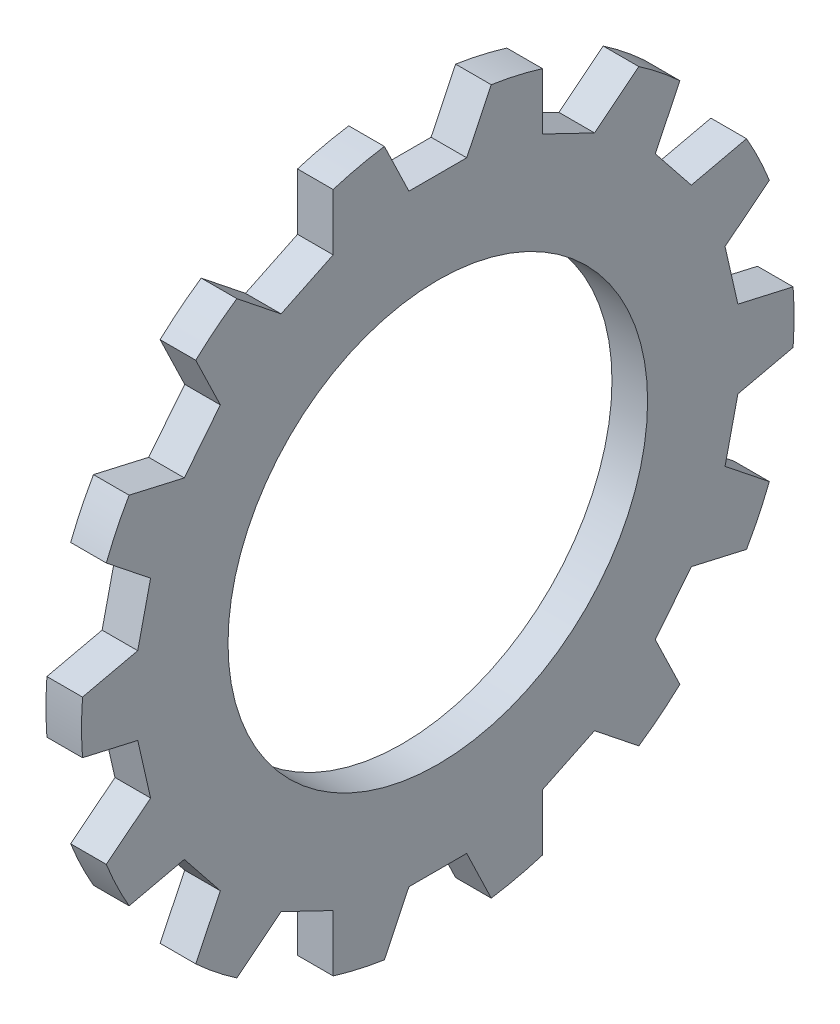
from build123d import *

# Parameters (mm, degrees)
SKETCH1_R          = 11.43
SKETCH1_R_2        = 6.731
BASE_EXTRUDE_DEPTH = 1.143
TYPEASLOT_DEPTH    = 17.204821782
TYPEAPATTERN_COUNT = 14


with BuildPart() as part:
    # Sketch1 → Base-Extrude (new body)
    with BuildSketch(Plane(origin=(0, 0, 0), x_dir=(0, 0, -1), z_dir=(1, 0, 0))):
        Circle(SKETCH1_R)
        Circle(SKETCH1_R_2, mode=Mode.SUBTRACT)
    extrude(amount=-BASE_EXTRUDE_DEPTH)

    # Sketch3 → TypeASlot (cut, through all)
    with BuildSketch(Plane(origin=(0, 0, 0), x_dir=(0, 0, -1), z_dir=(1, 0, 0))):
        Polygon((0.927060652, 9.663349983), (1.7145, 11.300680942), (1.7145, 12.329380942), (-1.7145, 12.329380942), (-1.7145, 11.300680942), (-0.927060652, 9.663349983), align=None)
    typeaslot = extrude(amount=-TYPEASLOT_DEPTH, mode=Mode.SUBTRACT)

    # TypeAPattern: TypeASlot ×14 about axis
    typeapattern_axis = Axis((-1.143, 0, 0), (1, 0, 0))
    for i in range(1, TYPEAPATTERN_COUNT):
        add(typeaslot.rotate(typeapattern_axis, i * 360 / TYPEAPATTERN_COUNT), mode=Mode.SUBTRACT)


solid = part.part
